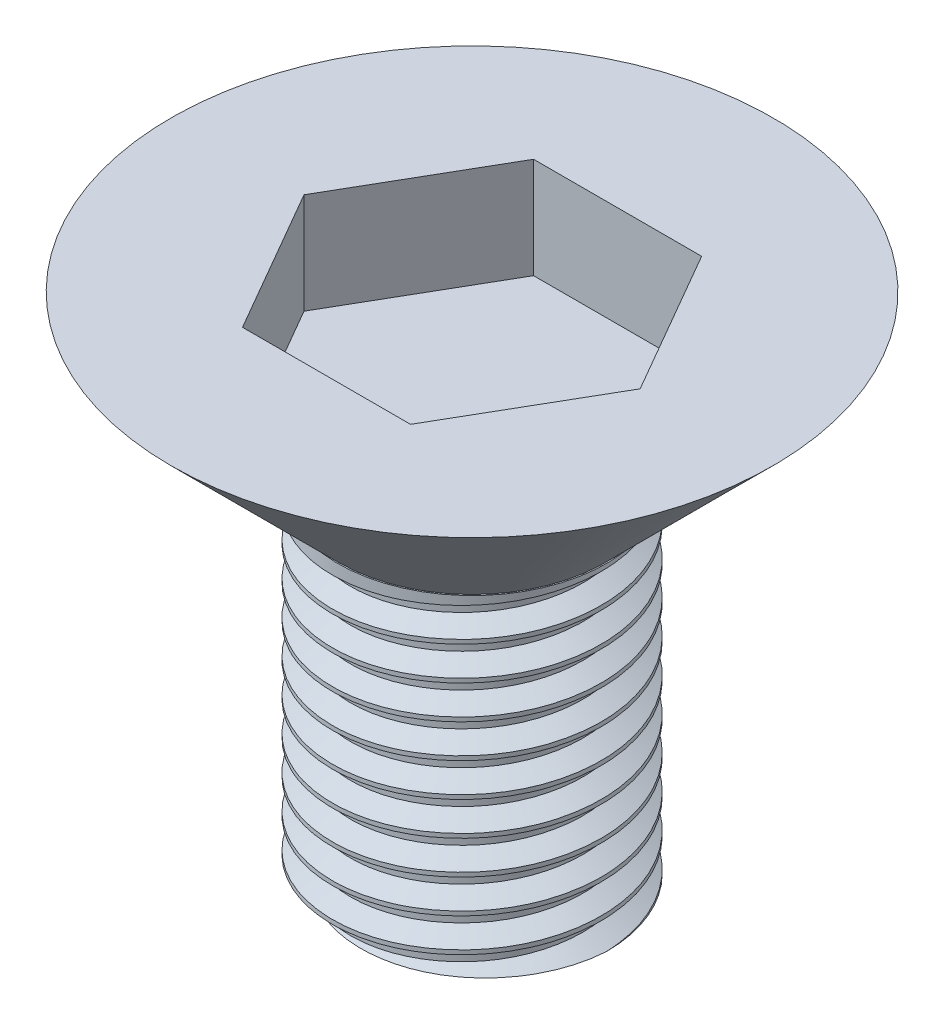
from build123d import *

# Parameters (mm, degrees)
CROQUIS24_R             = 8.96
SALIENTE_EXTRUIR1_DEPTH = 5
SALIENTE_EXTRUIR1_DRAFT = -45
CROQUIS26_R             = 4
SALIENTE_EXTRUIR2_DEPTH = 10
ROSCA1_PITCH            = 1
CORTAR_EXTRUIR2_DEPTH   = 3


with BuildPart() as part:
    # Croquis24 → Saliente-Extruir1 (with draft: the straight prism first)
    with BuildSketch(Plane(origin=(0, 0, 0), x_dir=(1, 0, 0), z_dir=(0, 1, 0))):
        Circle(CROQUIS24_R)
    extrude(amount=-SALIENTE_EXTRUIR1_DEPTH)
    # Saliente-Extruir1: the draft: its side faces are tilted about the plane it starts from
    saliente_extruir1_sides = [part.faces().sort_by_distance(p)[0] for p in [
        (-8.96, -2.5, 0),
    ]]
    draft(saliente_extruir1_sides, Plane(origin=(0, 0, 0), x_dir=(1, 0, 0), z_dir=(0, 1, 0)), SALIENTE_EXTRUIR1_DRAFT)

    # Croquis26 → Saliente-Extruir2 (add)
    with BuildSketch(Plane.XZ.offset(5)):
        with Locations(Location((0, 0, 0), (0, 0, 270))):
            Circle(CROQUIS26_R)
    extrude(amount=SALIENTE_EXTRUIR2_DEPTH)

    # Rosca1: the profile of Perfil de rosca1 profile screwed along a right-hand helix of 10.3 turns, 8 arcs to a turn; built about Z, then put on its axis
    rosca1_z = Axis((0, 0, 0), (0, 0, 1))
    rosca1_corners = [(4.0003, 0, -0.000173205), (4.0003, 0, 0.875173202), (3.458734125, 0, 0.562499999), (3.458734125, 0, 0.312499999)]
    with BuildLine(mode=Mode.PRIVATE) as rosca1_profile:
        Line(rosca1_corners[0], rosca1_corners[1])
        Line(rosca1_corners[1], rosca1_corners[2])
        Line(rosca1_corners[2], rosca1_corners[3])
        Line(rosca1_corners[3], rosca1_corners[0])
    rosca1_cap = Face(rosca1_profile.wire())
    rosca1_turn_angles = [0, 22.5, 45, 67.5, 90, 112.5, 135, 157.5, 180, 202.5, 225, 247.5, 270, 292.5, 315, 337.5, 360]
    rosca1_turn_weights = [1, 0.9238795325112867, 1, 0.9238795325112867, 1, 0.9238795325112867, 1, 0.9238795325112867, 1, 0.9238795325112867, 1, 0.9238795325112867, 1, 0.9238795325112867, 1, 0.9238795325112867, 1]
    rosca1_turn_rails = [Edge.make_bspline([Vector(p[0], p[1], 0).rotate(rosca1_z, rosca1_turn_angles[k]) / rosca1_turn_weights[k] + Vector(0, 0, p[2] + ROSCA1_PITCH * rosca1_turn_angles[k] / 360) for k in range(17)], [0, 0, 0, 1, 1, 2, 2, 3, 3, 4, 4, 5, 5, 6, 6, 7, 7, 8, 8, 8], 2, rosca1_turn_weights) for p in rosca1_corners]
    rosca1_turn_sides = [Face.make_surface_from_curves(rosca1_turn_rails[p[0]], rosca1_turn_rails[p[1]]) for p in [(0, 1), (1, 2), (2, 3), (3, 0)]]
    rosca1_turn = Solid(Shell([*rosca1_turn_sides, rosca1_cap, rosca1_cap.rotate(rosca1_z, 360).moved(Location((0, 0, ROSCA1_PITCH * 360 / 360)))]))
    rosca1_last_angles = [3600, 3622.5, 3645, 3667.5, 3690, 3699, 3708]
    rosca1_last_weights = [1, 0.9238795325112867, 1, 0.9238795325112867, 1, 0.9876883405951371, 1]
    rosca1_last_rails = [Edge.make_bspline([Vector(p[0], p[1], 0).rotate(rosca1_z, rosca1_last_angles[k]) / rosca1_last_weights[k] + Vector(0, 0, p[2] + ROSCA1_PITCH * rosca1_last_angles[k] / 360) for k in range(7)], [0, 0, 0, 1, 1, 2, 2, 3, 3, 3], 2, rosca1_last_weights) for p in rosca1_corners]
    rosca1_last_sides = [Face.make_surface_from_curves(rosca1_last_rails[p[0]], rosca1_last_rails[p[1]]) for p in [(0, 1), (1, 2), (2, 3), (3, 0)]]
    rosca1_last = Solid(Shell([*rosca1_last_sides, rosca1_cap.rotate(rosca1_z, 3600).moved(Location((0, 0, ROSCA1_PITCH * 3600 / 360))), rosca1_cap.rotate(rosca1_z, 3708).moved(Location((0, 0, ROSCA1_PITCH * 3708 / 360)))]))
    rosca1_each = [*[rosca1_turn.moved(Location((0, 0, ROSCA1_PITCH * i))) for i in range(10)], rosca1_last]
    add(Plane(origin=(0, -16, 0), x_dir=(1, 0, 0), z_dir=(0, 1, 0)) * Compound([rosca1_each[i] for i in range(0, 11, 2)]), mode=Mode.SUBTRACT)
    add(Plane(origin=(0, -16, 0), x_dir=(1, 0, 0), z_dir=(0, 1, 0)) * Compound([rosca1_each[i] for i in range(1, 11, 2)]), mode=Mode.SUBTRACT)

    # Croquis33 → Cortar-Extruir2 (cut)
    with BuildSketch(Plane(origin=(0, 0, 0), x_dir=(1, 0, 0), z_dir=(0, 1, 0))):
        Polygon((5, 0), (2.5, 4.330127019), (-2.5, 4.330127019), (-5, 0), (-2.5, -4.330127019), (2.5, -4.330127019), align=None)
    extrude(amount=-CORTAR_EXTRUIR2_DEPTH, mode=Mode.SUBTRACT)


solid = part.part
